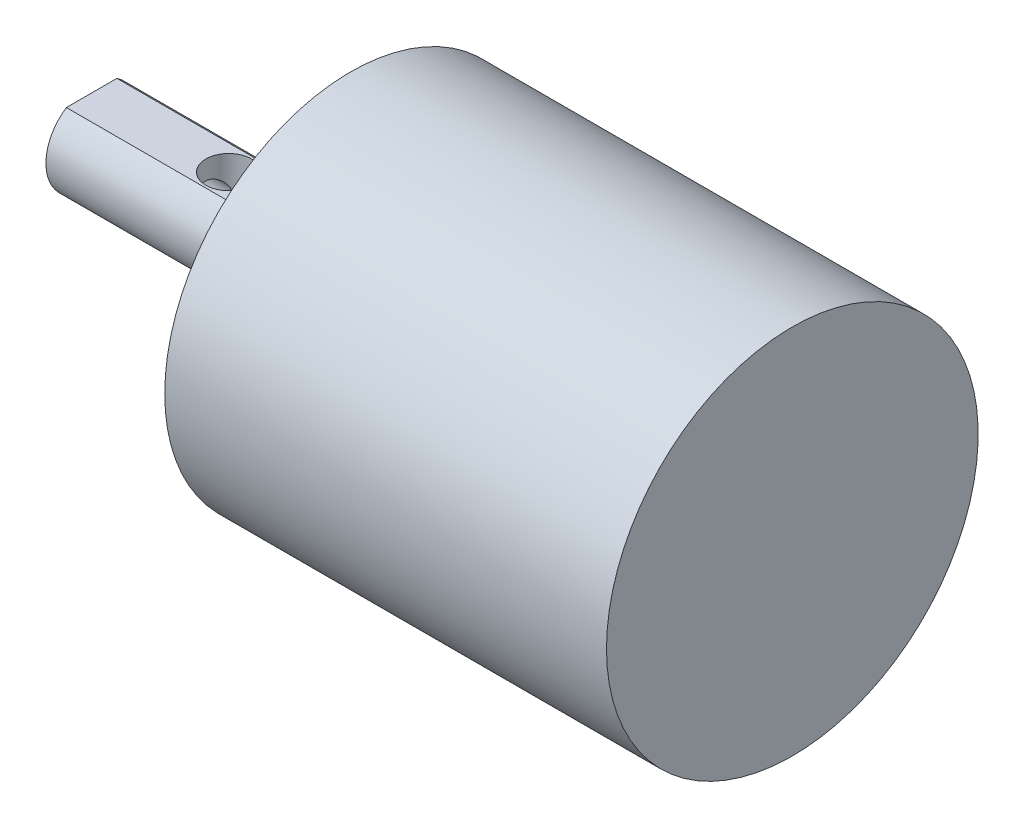
from build123d import *

# Parameters (mm, degrees)
CUT_EXTRUDE_3_DEPTH    = 11.5
HOLE_WIZARD_M3_1_D     = 2.5
HOLE_WIZARD_M3_1_DEPTH = 8
HOLE_WIZARD_M3_1_TIP   = 0.751075774
SKETCH_12_R            = 1.5
CUT_EXTRUDE_4_DEPTH    = 11.5
HOLE_WIZARD_M3_2_D     = 2.5
HOLE_WIZARD_M3_2_DEPTH = 4
HOLE_WIZARD_M3_2_TIP   = 0.751075774
EXTRUDE_START          = 0.5
EXTRUDE_1_DEPTH        = 0.5


with BuildPart() as part:
    # 草图1 → 旋转1 (revolve)
    with BuildSketch(Plane(origin=(0, 0, 0), x_dir=(1, 0, 0), z_dir=(0, 1, 0))):
        Polygon((0, 0), (-29, 0), (-29, 5.7), (-31.6, 5.7), (-31.6, 9.2), (-46, 9.2), (-46, 12.2), (0, 12.2), align=None)
    revolve(axis=Axis((-46, 0, -12.2), (1, 0, 0)))

    # 草图9 → 切除-拉伸3 (cut)
    with BuildSketch(Plane.ZY.offset(46)):
        with BuildLine():
            Line((-12.2, 2.5), (-10.541687605, 2.5))
            ThreePointArc((-10.541687605, 2.5), (-12.2, 3), (-13.858312395, 2.5))
            Line((-13.858312395, 2.5), (-12.2, 2.5))
        make_face()
    extrude(amount=-CUT_EXTRUDE_3_DEPTH, mode=Mode.SUBTRACT)

    # M3 螺纹孔1
    with Locations(Plane.ZY.offset(46)):
        with Locations((-12.2, 0)):
            Hole(HOLE_WIZARD_M3_1_D / 2, depth=HOLE_WIZARD_M3_1_DEPTH)
            with Locations((0, 0, -(HOLE_WIZARD_M3_1_DEPTH + HOLE_WIZARD_M3_1_TIP / 2))):  # 118° drill point
                Cone(0, HOLE_WIZARD_M3_1_D / 2, HOLE_WIZARD_M3_1_TIP, mode=Mode.SUBTRACT)

    # 草图12 → 切除-拉伸4 (cut)
    with BuildSketch(Plane(origin=(0, 2.5, 0), x_dir=(1, 0, 0), z_dir=(0, 1, 0))):
        with Locations((-37, 12.2)):
            Circle(SKETCH_12_R)
    extrude(amount=-CUT_EXTRUDE_4_DEPTH, mode=Mode.SUBTRACT)

    # M3 螺纹孔2
    with Locations(Plane.ZY.offset(29)):
        with Locations((-12.2, 9.5), (-20.427241336, -4.75), (-3.972758664, -4.75)):
            Hole(HOLE_WIZARD_M3_2_D / 2, depth=HOLE_WIZARD_M3_2_DEPTH)
            with Locations((0, 0, -(HOLE_WIZARD_M3_2_DEPTH + HOLE_WIZARD_M3_2_TIP / 2))):  # 118° drill point
                Cone(0, HOLE_WIZARD_M3_2_D / 2, HOLE_WIZARD_M3_2_TIP, mode=Mode.SUBTRACT)

    # 草图16 → 凸台-拉伸1 (add)
    with BuildSketch(Plane.ZY.offset(31.6).offset(EXTRUDE_START)):
        with BuildLine():
            Line((-9.601923789, -1.5), (-12.2, -6))
            ThreePointArc((-12.2, -6), (-8.525765386, 4.74341649), (-18.009475019, -1.5))
            Line((-18.009475019, -1.5), (-14.69206472, 1.670213589))
            ThreePointArc((-14.69206472, 1.670213589), (-10.614007201, 2.546493048), (-9.601923789, -1.5))
        make_face()
    extrude(amount=-EXTRUDE_1_DEPTH)


solid = part.part
